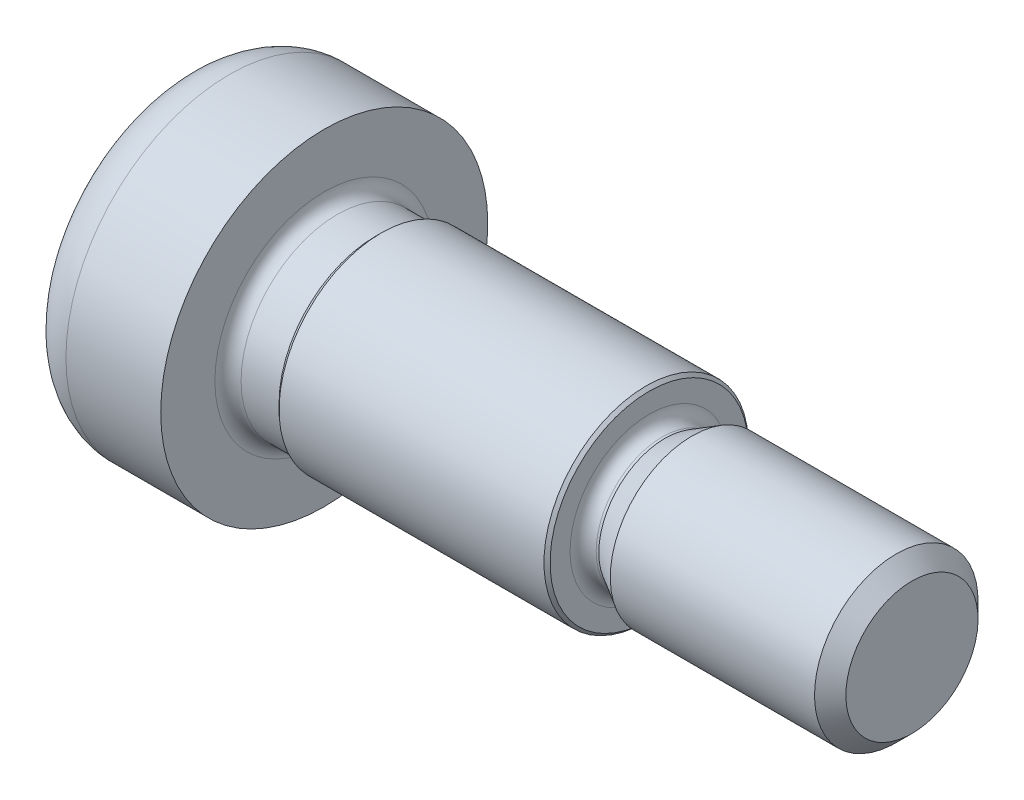
from build123d import *

# Parameters (mm, degrees)
DODANIE_WYCI_GNI_CIE1_START       = -7
DODANIE_WYCI_GNI_CIE1_OUTLINE_R   = 8
DODANIE_WYCI_GNI_CIE1_DEPTH       = 7
DODANIE_WYCI_GNI_CIE1_START_2     = -1.133333233
DODANIE_WYCI_GNI_CIE1_2_OUTLINE_R = 4.71
DODANIE_WYCI_GNI_CIE1_2_DEPTH     = 3.633333233
SZKIC2_R                          = 4.71
DODANIE_WYCI_GNI_CIE2_DEPTH       = 0.29
DODANIE_WYCI_GNI_CIE2_DRAFT       = -45
SZKIC3_R                          = 5
DODANIE_WYCI_GNI_CIE3_DEPTH       = 13.11
SZKIC4_R                          = 3.2331875
DODANIE_WYCI_GNI_CIE4_DEPTH       = 0.7668125
SZKIC5_R                          = 3.2331875
DODANIE_WYCI_GNI_CIE5_DEPTH       = 1.32815821
DODANIE_WYCI_GNI_CIE5_DRAFT       = -30
SZKIC6_R                          = 4
DODANIE_WYCI_GNI_CIE6_DEPTH       = 10.76
SFAZOWANIE1_SIZE                  = 0.7668125
SFAZOWANIE2_SIZE                  = 0.15
ZAOKR_GLENIE1_R                   = 0.64
ZAOKR_GLENIE2_R                   = 2.3622


with BuildPart() as part:
    # Dodanie-wyciągnięcie1: read off the stored shape, not the designer's step
    # Dodanie-wyciągnięcie1 outline → Dodanie-wyciągnięcie1 (new body)
    with BuildSketch(Plane(origin=(0, 0, 0), x_dir=(0, 0, -1), z_dir=(1, 0, 0)).offset(DODANIE_WYCI_GNI_CIE1_START)):
        Circle(DODANIE_WYCI_GNI_CIE1_OUTLINE_R)
        Polygon((0, 2.886751346), (2.5, 1.443375673), (2.5, -1.443375673), (0, -2.886751346), (-2.5, -1.443375673), (-2.5, 1.443375673), align=None, mode=Mode.SUBTRACT)
    extrude(amount=DODANIE_WYCI_GNI_CIE1_DEPTH)

    # Dodanie-wyci_gni_cie1 2 outline → Dodanie-wyci_gni_cie1 2 (add)
    with BuildSketch(Plane(origin=(0, 0, 0), x_dir=(0, 0, -1), z_dir=(1, 0, 0)).offset(DODANIE_WYCI_GNI_CIE1_START_2)):
        Circle(DODANIE_WYCI_GNI_CIE1_2_OUTLINE_R)
    extrude(amount=DODANIE_WYCI_GNI_CIE1_2_DEPTH)

    # Dodanie-wyci_gni_cie1 3 outline → Dodanie-wyci_gni_cie1 3 (revolve)
    with BuildSketch(Plane.YX):
        Polygon((2.886751346, -1.133333233), (0, -1.133333233), (2.886751346, -2.8), align=None)
    revolve(axis=Axis((0, 0, 0), (1, 0, 0)))


with BuildPart() as dodanie_wyci_gni_cie2_tool:
    # Szkic2 → Dodanie-wyciągnięcie2 (with draft: the straight prism first)
    with BuildSketch(Plane(origin=(2.5, 0, 0), x_dir=(0, 0, -1), z_dir=(1, 0, 0))):
        with Locations(Location((0, 0, 0), (0, 0, 90))):
            Circle(SZKIC2_R)
    extrude(amount=DODANIE_WYCI_GNI_CIE2_DEPTH)
    # Dodanie-wyciągnięcie2: the draft: its side faces are tilted about the plane it starts from
    dodanie_wyci_gni_cie2_sides = [dodanie_wyci_gni_cie2_tool.faces().sort_by_distance(p)[0] for p in [
        (2.645, -4.71, 0),
    ]]
    draft(dodanie_wyci_gni_cie2_sides, Plane(origin=(2.5, 0, 0), x_dir=(0, 0, -1), z_dir=(1, 0, 0)), DODANIE_WYCI_GNI_CIE2_DRAFT)


with BuildPart() as part_1:
    add(part.part)

    # Dodanie-wyciągnięcie2: add dodanie_wyci_gni_cie2_tool
    add(dodanie_wyci_gni_cie2_tool.part)

    # Szkic3 → Dodanie-wyciągnięcie3 (add)
    with BuildSketch(Plane(origin=(2.79, 0, 0), x_dir=(0, 0, -1), z_dir=(1, 0, 0))):
        with Locations(Location((0, 0, 0), (0, 0, 270))):
            Circle(SZKIC3_R)
    extrude(amount=DODANIE_WYCI_GNI_CIE3_DEPTH)

    # Szkic4 → Dodanie-wyciągnięcie4 (add)
    with BuildSketch(Plane(origin=(15.9, 0, 0), x_dir=(0, 0, -1), z_dir=(1, 0, 0))):
        with Locations(Location((0, 0, 0), (0, 0, 270))):
            Circle(SZKIC4_R)
    extrude(amount=DODANIE_WYCI_GNI_CIE4_DEPTH)


with BuildPart() as dodanie_wyci_gni_cie5_tool:
    # Szkic5 → Dodanie-wyciągnięcie5 (with draft: the straight prism first)
    with BuildSketch(Plane(origin=(16.6668125, 0, 0), x_dir=(0, 0, -1), z_dir=(1, 0, 0))):
        with Locations(Location((0, 0, 0), (0, 0, 270))):
            Circle(SZKIC5_R)
    extrude(amount=DODANIE_WYCI_GNI_CIE5_DEPTH)
    # Dodanie-wyciągnięcie5: the draft: its side faces are tilted about the plane it starts from
    dodanie_wyci_gni_cie5_sides = [dodanie_wyci_gni_cie5_tool.faces().sort_by_distance(p)[0] for p in [
        (17.330891605, 3.2331875, 0),
    ]]
    draft(dodanie_wyci_gni_cie5_sides, Plane(origin=(16.6668125, 0, 0), x_dir=(0, 0, -1), z_dir=(1, 0, 0)), DODANIE_WYCI_GNI_CIE5_DRAFT)


with BuildPart() as part_2:
    add(part_1.part)

    # Dodanie-wyciągnięcie5: add dodanie_wyci_gni_cie5_tool
    add(dodanie_wyci_gni_cie5_tool.part)

    # Szkic6 → Dodanie-wyciągnięcie6 (add)
    with BuildSketch(Plane(origin=(17.99497071, 0, 0), x_dir=(0, 0, -1), z_dir=(1, 0, 0))):
        with Locations(Location((0, 0, 0), (0, 0, 90))):
            Circle(SZKIC6_R)
    extrude(amount=DODANIE_WYCI_GNI_CIE6_DEPTH)

    # Sfazowanie1
    sfazowanie1_edges = [part_2.edges().sort_by_distance(p)[0] for p in [
        (28.75497071, -4, 0),
    ]]
    chamfer(sfazowanie1_edges, length=SFAZOWANIE1_SIZE)

    # Sfazowanie2
    sfazowanie2_edges = [part_2.edges().sort_by_distance(p)[0] for p in [
        (15.9, 5, 0),
    ]]
    chamfer(sfazowanie2_edges, length=SFAZOWANIE2_SIZE)

    # Zaokrąglenie1
    zaokr_glenie1_edges = [part_2.edges().sort_by_distance(p)[0] for p in [
        (0, 0, 4.71),
        (15.9, 3.2331875, 0),
    ]]
    fillet(zaokr_glenie1_edges, radius=ZAOKR_GLENIE1_R)

    # Zaokrąglenie2
    zaokr_glenie2_edges = [part_2.edges().sort_by_distance(p)[0] for p in [
        (-7, 0, 8),
    ]]
    fillet(zaokr_glenie2_edges, radius=ZAOKR_GLENIE2_R)


solid = part_2.part
